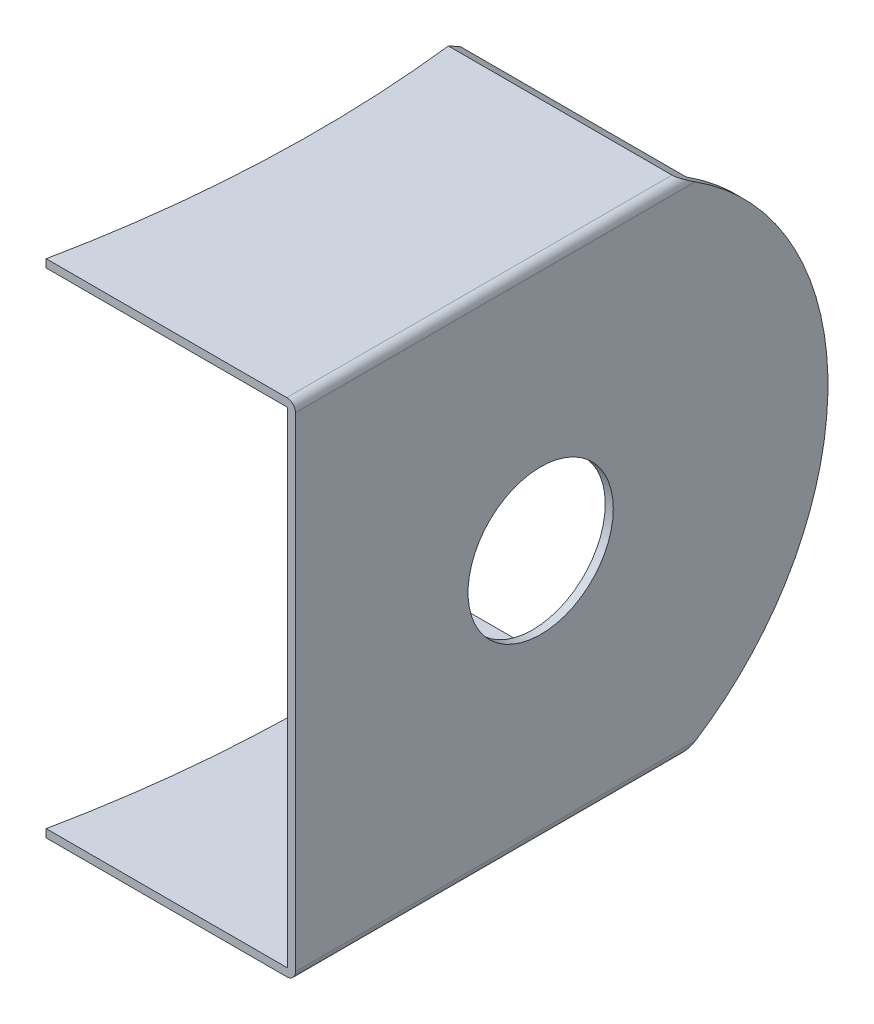
from build123d import *

# Parameters (mm, degrees)
SKETCH1_W               = 730
SKETCH1_H               = 150
BASE_FLANGE1_DEPTH      = 2.5
EDGE_FLANGE1_DEPTH      = 730
EDGE_FLANGE1_BEND_DEPTH = 730
SKETCH13_R              = 22.5
CUT_EXTRUDE2_DEPTH      = 10
CUT_EXTRUDE3_DEPTH      = 396.173746598
CUT_EXTRUDE3_DEPTH_BACK = 396.173746598
SKETCH14_W              = 631.337566112
SKETCH14_H              = 273.157514278
CUT_EXTRUDE4_DEPTH      = 396.173746598
CUT_EXTRUDE4_DEPTH_BACK = 396.173746598
CUT_EXTRUDE5_DEPTH      = 408.87885472


# Sheet-metal steps are written as plain solids
with BuildPart() as part:
    # Sketch1 → Base-Flange1 (new body)
    with BuildSketch(Plane(origin=(0, 0, 0), x_dir=(0, 0, -1), z_dir=(1, 0, 0))):
        Rectangle(SKETCH1_W, SKETCH1_H)
    extrude(amount=-BASE_FLANGE1_DEPTH)

    # Edge-Flange1 section (across the edge) → Edge-Flange1 (add)
    with BuildSketch(Plane(origin=(-2.5, 75.2, 365), x_dir=(0, -1, 0), z_dir=(0, 0, -1))):
        with BuildLine():
            Line((-2.5, 0.2), (-2.5, 127.5))
            Line((-2.5, 127.5), (0, 127.5))
            Line((0, 127.5), (0, 0.2))
            ThreePointArc((0, 0.2), (0.058578644, 0.058578644), (0.2, 0))
            Line((0.2, 0), (0.2, -2.5))
            ThreePointArc((0.2, -2.5), (-1.709188309, -1.709188309), (-2.5, 0.2))
        make_face()
    extrude(amount=EDGE_FLANGE1_DEPTH)

    # Edge-Flange1 section 2 (across the edge) → Edge-Flange1 bend (add)
    with BuildSketch(Plane(origin=(-2.5, -75.2, -365), x_dir=(0, 1, 0), z_dir=(0, 0, 1))):
        with BuildLine():
            Line((-2.5, 0.2), (-2.5, 127.5))
            Line((-2.5, 127.5), (0, 127.5))
            Line((0, 127.5), (0, 0.2))
            ThreePointArc((0, 0.2), (0.058578644, 0.058578644), (0.2, 0))
            Line((0.2, 0), (0.2, -2.5))
            ThreePointArc((0.2, -2.5), (-1.709188309, -1.709188309), (-2.5, 0.2))
        make_face()
    extrude(amount=EDGE_FLANGE1_BEND_DEPTH)

    # Sketch13 → Cut-Extrude2 (cut)
    with BuildSketch(Plane(origin=(0, 0, 0), x_dir=(0, 0, -1), z_dir=(1, 0, 0))):
        with Locations((265, 0)):
            Circle(SKETCH13_R)
        with Locations((-290, 0)):
            Circle(SKETCH13_R)
    extrude(amount=-CUT_EXTRUDE2_DEPTH, mode=Mode.SUBTRACT)

    # Sketch14 → Cut-Extrude3 (cut, two sides: drawn at the far end of the back side and taken through both)
    with BuildSketch(Plane(origin=(0, 0, 0), x_dir=(0, 0, -1), z_dir=(1, 0, 0)).offset(-CUT_EXTRUDE3_DEPTH_BACK)):
        with Locations((-126.629311255, -14.019673746)):
            Rectangle(SKETCH14_W, SKETCH14_H)
    extrude(amount=CUT_EXTRUDE3_DEPTH + CUT_EXTRUDE3_DEPTH_BACK, mode=Mode.SUBTRACT)

    # Sketch15 → Cut-Extrude4 (cut, two sides: drawn at the far end of the back side and taken through both)
    with BuildSketch(Plane(origin=(0, 0, 0), x_dir=(0, 0, -1), z_dir=(1, 0, 0)).offset(-CUT_EXTRUDE4_DEPTH_BACK)):
        with BuildLine():
            Line((302.266550641, 80.822052704), (310.532003477, 105.351783703))
            Line((310.532003477, 105.351783703), (400.668447303, 94.566226322))
            Line((400.668447303, 94.566226322), (380.252927975, -108.048173048))
            Line((380.252927975, -108.048173048), (291.286888445, -85.029403714))
            ThreePointArc((291.286888445, -85.029403714), (353.805609642, -5.879089735), (302.266550641, 80.822052704))
        make_face()
    extrude(amount=CUT_EXTRUDE4_DEPTH + CUT_EXTRUDE4_DEPTH_BACK, mode=Mode.SUBTRACT)

    # Sketch17 → Cut-Extrude5 (cut, through all)
    with BuildSketch(Plane(origin=(0, 77.7, 0), x_dir=(1, 0, 0), z_dir=(0, 1, 0))):
        with BuildLine():
            Line((-169.942990536, 157.436912633), (-165.65841416, 335.00880021))
            Line((-165.65841416, 335.00880021), (-74.315703794, 325.146670386))
            ThreePointArc((-74.315703794, 325.146670386), (-69.663025193, 253.273874783), (-78.78147448, 181.830190328))
            Line((-78.78147448, 181.830190328), (-169.942990536, 157.436912633))
        make_face()
    extrude(amount=-CUT_EXTRUDE5_DEPTH, mode=Mode.SUBTRACT)


solid = part.part
